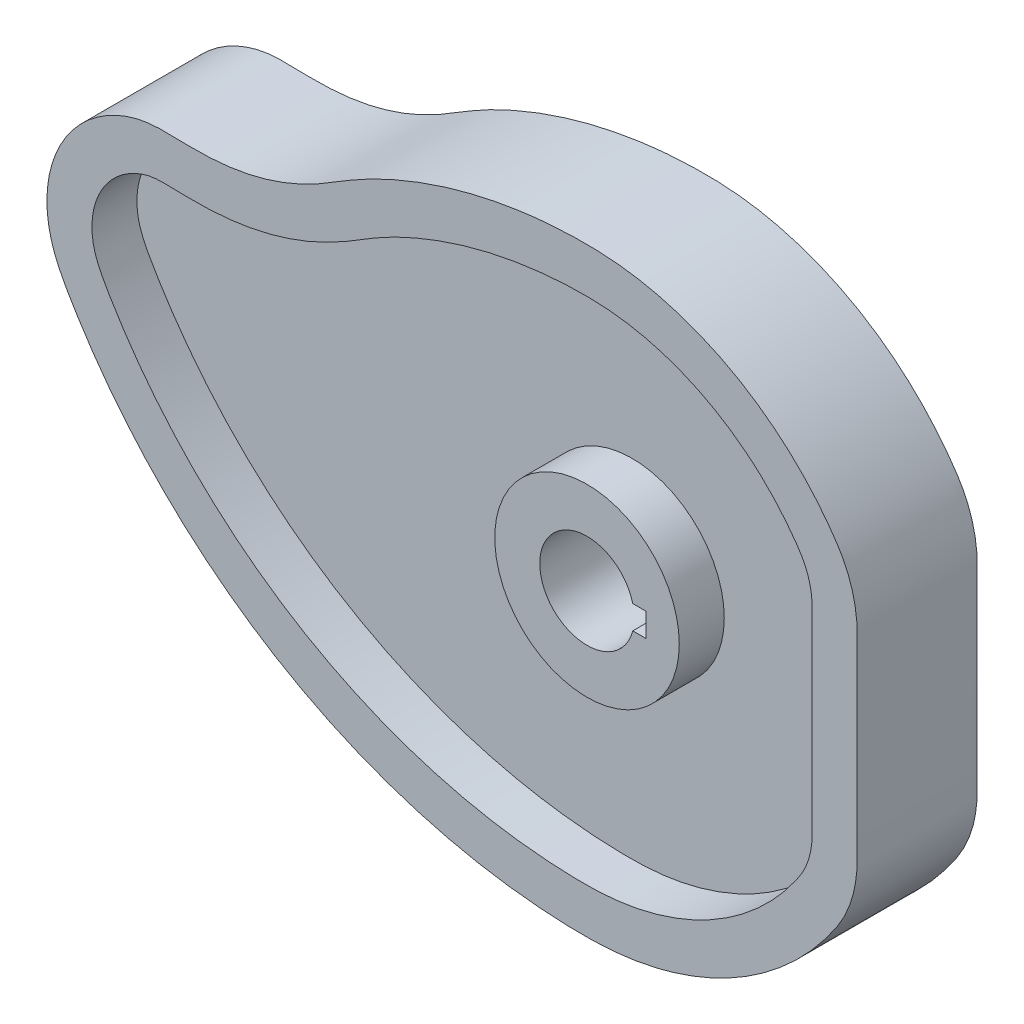
from build123d import *

# Parameters (mm, degrees)
EXTRUDE1_START     = -25.4
EXTRUDE1_DEPTH     = 50.8
SKETCH2_R          = 39.05
CUT_EXTRUDE1_DEPTH = 19.05


# Read off the part's stored shape, not the designer's step: Extrude1
with BuildPart() as part:
    # Extrude1 outline → Extrude1 (new body)
    with BuildSketch(Plane.XY.offset(EXTRUDE1_START)):
        with BuildLine():
            add(Edge.make_bspline(
                [(-28.849609409, 124.941592012), (-48.01729736, 122.192382835), (-66.600494499, 116.749663241), (-84.222706717, 108.723702302), (-88.834406259, 106.623323535), (-97.900665142, 102.077540905), (-110.693663801, 93.768091001), (-119.707980615, 89.074000214), (-124.3646687, 87.075345741), (-134.644197589, 82.66336323), (-145.507212428, 79.993304716), (-156.660747873, 79.137179178), (-161.496559268, 78.765990899), (-171.221339831, 78.716149607), (-186.352461546, 79.419861216), (-195.681579206, 76.421745576), (-200.04202976, 74.298228789), (-217.372093969, 65.858577469), (-227.881133527, 49.699402752), (-228.567760678, 30.43577425), (-228.780109226, 24.478241792), (-227.107479642, 12.488420376), (-217.756575855, -4.167304239), (-211.244905561, -14.16347672), (-207.817362663, -19.040897614), (-165.939670094, -78.633188309), (-103.494941124, -116.125028343), (-31.211615199, -125.075058418), (-24.352559539, -125.924338023), (-10.565120582, -127.0629849), (10.578278376, -127.128584592), (24.259156987, -124.852958406), (30.962049694, -123.167980737), (59.439189889, -116.009378115), (83.89747474, -99.761750372), (101.535282732, -76.286213437), (102.527158243, -74.966048811), (104.459414811, -72.287030379), (107.224849214, -68.140040359), (108.775057745, -65.219528674), (109.477294002, -63.725033472), (111.593713039, -59.220882534), (113.030335386, -54.456145245), (113.756415965, -49.532791489), (113.876888839, -48.715897891), (114.077999963, -47.076236012), (114.3, -44.598322713), (114.3, -42.946864129), (114.3, -42.121134838), (114.3, -41.295405546), (114.3, -39.643946962), (114.3, -37.166759087), (114.3, -35.515300504), (114.3, -34.689571212), (114.3, -11.563190404), (114.3, 11.563190404), (114.3, 34.689571212), (114.3, 35.515300504), (114.3, 37.166759087), (114.3, 39.643946962), (114.3, 41.295405546), (114.3, 42.121134838), (114.3, 42.946864129), (114.3, 44.598322713), (114.077999963, 47.076236012), (113.876888839, 48.715897891), (113.756415965, 49.532791489), (113.030335386, 54.456145245), (111.593713039, 59.220882534), (109.477294002, 63.725033472), (108.775057745, 65.219528674), (107.224849214, 68.140040359), (104.459414811, 72.287030379), (102.527158243, 74.966048811), (101.535282732, 76.286213437), (83.89747474, 99.761750372), (59.439189889, 116.009378115), (30.962049694, 123.167980737), (24.51400116, 124.788895506), (11.363331344, 127.018026868), (-9.013020255, 127.127434139), (-22.268298971, 125.885545142), (-28.849609409, 124.941592012)],
                knots=[0, 0, 0, 0, 0.061242195, 0.061242195, 0.061242195, 0.077378132, 0.093514069, 0.109650007, 0.109650007, 0.109650007, 0.144949497, 0.144949497, 0.144949497, 0.160393044, 0.175836592, 0.191280139, 0.191280139, 0.191280139, 0.246815342, 0.246815342, 0.246815342, 0.265797439, 0.284779537, 0.303761634, 0.303761634, 0.303761634, 0.522402747, 0.522402747, 0.522402747, 0.544410223, 0.566417699, 0.588425175, 0.588425175, 0.588425175, 0.678353623, 0.678353623, 0.678353623, 0.683611579, 0.688869534, 0.694127489, 0.694127489, 0.694127489, 0.709861017, 0.709861017, 0.709861017, 0.712490315, 0.715119612, 0.71774891, 0.71774891, 0.71774891, 0.720378208, 0.723007505, 0.725636803, 0.725636803, 0.725636803, 0.799276118, 0.799276118, 0.799276118, 0.801905416, 0.804534714, 0.807164011, 0.807164011, 0.807164011, 0.809793309, 0.812422607, 0.815051904, 0.815051904, 0.815051904, 0.830785432, 0.830785432, 0.830785432, 0.836043387, 0.841301343, 0.846559298, 0.846559298, 0.846559298, 0.936487747, 0.936487747, 0.936487747, 0.957658498, 0.978829249, 1, 1, 1, 1], degree=3, weights=[1, 0.993246693, 0.993246693, 1, 1, 1, 1, 1, 1, 0.991010312, 0.991010312, 1, 1, 1, 1, 1, 1, 0.904799808, 0.904799808, 1, 1, 1, 1, 1, 1, 0.942731011, 0.942731011, 1, 1, 1, 1, 1, 1, 0.961817689, 0.961817689, 1, 1, 1, 1, 1, 1, 0.992866351, 0.992866351, 1, 1, 1, 1, 1, 1, 1, 1, 1, 1, 1, 1, 1, 1, 1, 1, 1, 1, 1, 1, 1, 1, 1, 1, 0.992866351, 0.992866351, 1, 1, 1, 1, 1, 1, 0.961817689, 0.961817689, 1, 1, 1, 1, 1, 1]))
        make_face()
        with BuildLine():
            Line((19.364916731, 5), (25, 5))
            Line((25, 5), (25, -5))
            Line((25, -5), (19.364916731, -5))
            ThreePointArc((19.364916731, -5), (-20, 0), (19.364916731, 5))
        make_face(mode=Mode.SUBTRACT)
    extrude(amount=EXTRUDE1_DEPTH)

    # Sketch2 → Cut-Extrude1 (cut)
    with BuildSketch(Plane.XY.offset(25.4)):
        with BuildLine():
            add(Edge.make_bspline(
                [(-28.870744059, -106.169429037), (-24.620284709, -106.695715543), (-20.372637691, -107.103432088), (-14.005225595, -107.54390047), (-11.883430327, -107.662246621), (-7.641153467, -107.843553339), (-5.52066604, -107.90675995), (0.838102875, -107.982825493), (5.073761877, -107.885118476), (13.532909512, -107.176592749), (17.756387199, -106.565312558), (23.02789352, -105.470638962), (24.081802137, -105.235149958), (26.188825979, -104.73072195), (27.238792531, -104.462513605), (30.36518246, -103.613814055), (32.423498594, -102.98796387), (38.522182314, -100.933888376), (42.486548806, -99.329748235), (50.214130854, -95.655876852), (53.977365228, -93.586189167), (58.551308215, -90.697945525), (59.460372614, -90.10458265), (61.253369888, -88.895423973), (62.138726049, -88.278767735), (64.761778727, -86.39301446), (66.466489442, -85.088165385), (71.450811549, -81.032922063), (74.601063614, -78.142320227), (79.067752213, -73.526033897), (80.513420697, -71.940418932), (82.616067508, -69.490617796), (83.305966341, -68.662112894), (84.663534764, -66.981009669), (85.332058509, -66.127271589), (86.642061012, -64.401316142), (87.283019413, -63.529703015), (88.53837366, -61.770142583), (89.155883601, -60.884110237), (90.049413472, -59.53493188), (90.341150844, -59.081451034), (90.903337772, -58.161398773), (91.17272725, -57.694175482), (91.944065821, -56.269857731), (92.41042289, -55.290876582), (93.037740758, -53.77799583), (93.23525787, -53.264523904), (93.600862446, -52.23541981), (93.76943476, -51.718873543), (94.233618695, -50.163414219), (94.487805087, -49.118695741), (94.888970956, -47.014234576), (95.030034073, -45.953662759), (95.166584372, -44.622373329), (95.191912533, -44.355837695), (95.230891185, -43.821129894), (95.24058254, -43.552402885), (95.253114358, -42.743903591), (95.25, -42.203296786), (95.25, -24.377675136), (95.25, 1.550501808), (95.25, 28.559019459), (95.25, 38.282085813), (95.25, 40.442767225), (95.251827424, 41.523108465), (95.249161939, 42.873533569), (95.248027129, 43.143618415), (95.236769714, 43.683785482), (95.222753227, 43.952244687), (95.158692271, 44.752874386), (95.100338864, 45.283376349), (94.971806937, 46.341923086), (94.89748289, 46.869106444), (94.720911831, 47.91767093), (94.619550069, 48.439236008), (94.276312529, 49.995795632), (93.995386304, 51.022675723), (93.32734289, 53.054370042), (92.938129303, 54.062586128), (92.069702284, 56.012636814), (91.589435194, 56.959813905), (90.53520295, 58.797509578), (89.958031408, 59.68608928), (88.76857322, 61.442014848), (88.158104823, 62.310460194), (86.913978256, 64.033328208), (86.27804884, 64.887840665), (84.335293078, 67.418729986), (82.995763688, 69.060627114), (78.846728793, 73.852920652), (75.907214223, 76.87036678), (71.239933363, 81.132689986), (69.641061126, 82.509377109), (66.356123151, 85.17358526), (64.66885782, 86.461969364), (59.480839975, 90.185117664), (55.910103865, 92.43879738), (48.552900417, 96.506408266), (44.766406971, 98.320286216), (38.924294466, 100.710121855), (36.949793545, 101.451431516), (33.946643747, 102.479009086), (32.938689517, 102.807461158), (30.908797944, 103.435861994), (29.885967772, 103.736006051), (24.770019112, 105.155546644), (20.647100806, 106.041301097), (14.417542737, 106.995600068), (12.333476042, 107.251168127), (8.150163741, 107.636543151), (6.050819639, 107.765534056), (1.839396191, 107.918001161), (-0.272677801, 107.941521722), (-4.507376788, 107.901145147), (-6.632454793, 107.837044505), (-12.974936445, 107.538591559), (-17.174381873, 107.194853789), (-29.687400077, 105.735895497), (-37.916880783, 104.199076617), (-50.093824302, 101.055196863), (-54.124795702, 99.866809024), (-60.12845138, 97.86964094), (-62.122529993, 97.168121893), (-66.0961956, 95.692429585), (-68.074921486, 94.91848806), (-72.002813163, 93.303176336), (-73.953797, 92.461146887), (-77.829714074, 90.708005101), (-79.754886466, 89.797526972), (-83.572732132, 87.89038717), (-85.465398533, 86.893707271), (-89.210150463, 84.792732144), (-91.059609605, 83.681472067), (-94.747724858, 81.430303648), (-96.586864263, 80.291676938), (-100.283054628, 78.061922693), (-102.140894878, 76.972888254), (-107.762992736, 73.834605273), (-111.571777079, 71.903435991), (-119.344413881, 68.452318421), (-123.309500523, 66.935643032), (-131.398327432, 64.323021561), (-135.521838686, 63.22646817), (-143.932265033, 61.46668766), (-148.219129827, 60.803327158), (-154.780593992, 60.156124598), (-156.990368905, 60.000376294), (-160.335911306, 59.848643767), (-161.457408405, 59.811381073), (-163.69982254, 59.760611216), (-164.821415412, 59.747036393), (-168.187157946, 59.735819046), (-170.432310113, 59.768864819), (-173.801014062, 59.848301237), (-174.924033707, 59.878402285), (-177.169509387, 59.921351338), (-178.291977663, 59.934574068), (-180.535147787, 59.906946251), (-181.655902921, 59.867726899), (-183.333917063, 59.713433667), (-183.892675983, 59.644274569), (-185.008679287, 59.459593897), (-185.565972253, 59.34555954), (-186.679195641, 59.075781084), (-187.237270677, 58.919228151), (-188.332634247, 58.572438592), (-188.871894205, 58.381892296), (-190.466913535, 57.7639003), (-191.500248548, 57.290786154), (-193.514562864, 56.237932564), (-194.494899001, 55.656883275), (-195.924127178, 54.701248429), (-196.395023052, 54.367582954), (-197.314022335, 53.67807776), (-197.76234711, 53.322234225), (-199.949165555, 51.488622729), (-201.525133582, 49.849549768), (-203.275940417, 47.583201306), (-203.61594644, 47.117569763), (-204.268438986, 46.170872707), (-204.580455128, 45.690678602), (-205.474696321, 44.229984415), (-206.015232733, 43.229429509), (-206.986740651, 41.175612174), (-207.417713519, 40.122350401), (-208.16793768, 37.962081842), (-208.487876061, 36.849625171), (-209.255973841, 33.506236413), (-209.523894255, 31.250131889), (-209.554205349, 28.396093729), (-209.544767245, 27.82356057), (-209.493640827, 26.674904094), (-209.451865134, 26.099654689), (-209.27912599, 24.390764666), (-209.100610844, 23.266747488), (-208.617250325, 21.049107091), (-208.312386708, 19.955488262), (-207.758509691, 18.338296714), (-207.557866423, 17.803086559), (-207.131107517, 16.738794682), (-206.904560674, 16.208906897), (-206.199652129, 14.639047685), (-205.694950561, 13.61464109), (-204.641815544, 11.59371338), (-204.093132942, 10.597351138), (-202.968319886, 8.622128682), (-202.392089457, 7.643332217), (-201.224659582, 5.695284228), (-200.634178974, 4.725574339), (-198.844216721, 1.828254162), (-197.625092727, -0.086831251), (-193.885386875, -5.779587584), (-191.281915584, -9.504404343), (-187.208677267, -14.984484855), (-185.821168474, -16.795606374), (-183.000506159, -20.3685781), (-181.567510653, -22.130407835), (-177.201387637, -27.342860486), (-174.201181125, -30.72050939), (-164.936871989, -40.566593056), (-158.4099324, -46.749092331), (-144.658223916, -58.354935253), (-137.433524319, -63.778354288), (-127.951147543, -70.066447082), (-126.031202312, -71.299785928), (-122.171099772, -73.701000087), (-120.227876658, -74.870963543), (-114.359159034, -78.290010069), (-110.394649408, -80.448326458), (-98.347518027, -86.565927223), (-90.111791435, -90.169020994), (-73.232640144, -96.426719648), (-64.589264299, -99.081438187), (-51.306701833, -102.32487144), (-46.851016334, -103.276365838), (-40.13511234, -104.507786545), (-37.890550647, -104.885731966), (-34.514807152, -105.403800725), (-32.824709844, -105.650620993), (-30.849028791, -105.917169646), (-29.860212045, -106.045086378), (-29.365559478, -106.107704581), (-29.118172127, -106.138678542), (-29.01213589, -106.15188127), (-28.941442156, -106.160667126), (-28.903950773, -106.165317424), (-28.870744059, -106.169429037)],
                knots=[0, 0, 0, 0, 0.015625, 0.015625, 0.0234375, 0.0234375, 0.03125, 0.03125, 0.046875, 0.046875, 0.0625, 0.0625, 0.06640625, 0.06640625, 0.0703125, 0.0703125, 0.078125, 0.078125, 0.09375, 0.09375, 0.109375, 0.109375, 0.11328125, 0.11328125, 0.1171875, 0.1171875, 0.125, 0.125, 0.140625, 0.140625, 0.1484375, 0.1484375, 0.15234375, 0.15234375, 0.15625, 0.15625, 0.16015625, 0.16015625, 0.1640625, 0.1640625, 0.166015625, 0.166015625, 0.16796875, 0.16796875, 0.171875, 0.171875, 0.173828125, 0.173828125, 0.17578125, 0.17578125, 0.1796875, 0.1796875, 0.18359375, 0.18359375, 0.184570313, 0.184570313, 0.185546875, 0.185546875, 0.1875, 0.1875, 0.25, 0.28125, 0.28515625, 0.28515625, 0.2890625, 0.2890625, 0.290039063, 0.290039063, 0.291015625, 0.291015625, 0.29296875, 0.29296875, 0.294921875, 0.294921875, 0.296875, 0.296875, 0.30078125, 0.30078125, 0.3046875, 0.3046875, 0.30859375, 0.30859375, 0.3125, 0.3125, 0.31640625, 0.31640625, 0.3203125, 0.3203125, 0.328125, 0.328125, 0.34375, 0.34375, 0.3515625, 0.3515625, 0.359375, 0.359375, 0.375, 0.375, 0.390625, 0.390625, 0.3984375, 0.3984375, 0.40234375, 0.40234375, 0.40625, 0.40625, 0.421875, 0.421875, 0.4296875, 0.4296875, 0.4375, 0.4375, 0.4453125, 0.4453125, 0.453125, 0.453125, 0.46875, 0.46875, 0.5, 0.5, 0.515625, 0.515625, 0.5234375, 0.5234375, 0.53125, 0.53125, 0.5390625, 0.5390625, 0.546875, 0.546875, 0.5546875, 0.5546875, 0.5625, 0.5625, 0.5703125, 0.5703125, 0.578125, 0.578125, 0.59375, 0.59375, 0.609375, 0.609375, 0.625, 0.625, 0.640625, 0.640625, 0.6484375, 0.6484375, 0.65234375, 0.65234375, 0.65625, 0.65625, 0.6640625, 0.6640625, 0.66796875, 0.66796875, 0.671875, 0.671875, 0.67578125, 0.67578125, 0.677734375, 0.677734375, 0.6796875, 0.6796875, 0.681640625, 0.681640625, 0.68359375, 0.68359375, 0.6875, 0.6875, 0.69140625, 0.69140625, 0.693359375, 0.693359375, 0.6953125, 0.6953125, 0.703125, 0.703125, 0.705078125, 0.705078125, 0.70703125, 0.70703125, 0.7109375, 0.7109375, 0.71484375, 0.71484375, 0.71875, 0.71875, 0.7265625, 0.7265625, 0.728515625, 0.728515625, 0.73046875, 0.73046875, 0.734375, 0.734375, 0.73828125, 0.73828125, 0.740234375, 0.740234375, 0.7421875, 0.7421875, 0.74609375, 0.74609375, 0.75, 0.75, 0.75390625, 0.75390625, 0.7578125, 0.7578125, 0.765625, 0.765625, 0.78125, 0.78125, 0.7890625, 0.7890625, 0.796875, 0.796875, 0.8125, 0.8125, 0.84375, 0.84375, 0.875, 0.875, 0.8828125, 0.8828125, 0.890625, 0.890625, 0.90625, 0.90625, 0.9375, 0.9375, 0.96875, 0.96875, 0.984375, 0.984375, 0.9921875, 0.9921875, 0.99609375, 0.998046875, 0.999023438, 0.999511719, 0.999755859, 0.99987793, 0.99987793, 1, 1, 1, 1], degree=3))
        make_face()
        Circle(SKETCH2_R, mode=Mode.SUBTRACT)
    cut_extrude1 = extrude(amount=-CUT_EXTRUDE1_DEPTH, mode=Mode.SUBTRACT)

    # Mirror1: Cut-Extrude1 across plane
    add(cut_extrude1.mirror(Plane.XY), mode=Mode.SUBTRACT)


solid = part.part
